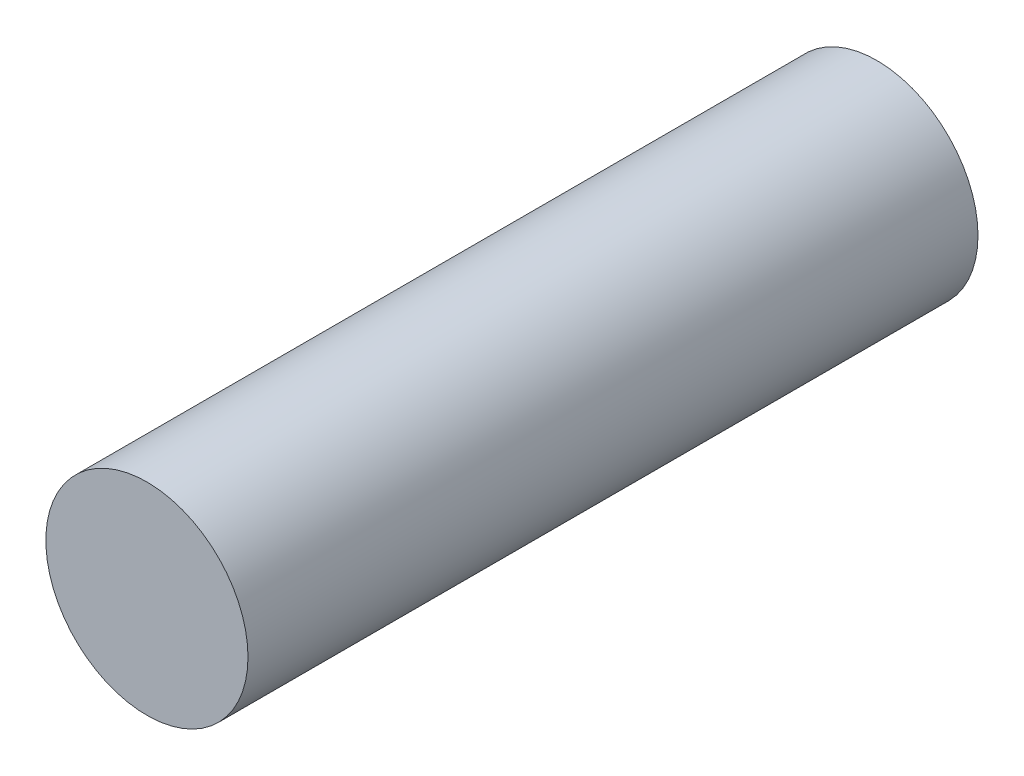
from build123d import *

# Parameters (mm, degrees)
SKETCH1_R           = 9
BOSS_EXTRUDE1_DEPTH = 65


with BuildPart() as part:
    # Sketch1 → Boss-Extrude1 (new body)
    with BuildSketch(Plane.XY):
        Circle(SKETCH1_R)
    extrude(amount=BOSS_EXTRUDE1_DEPTH)


solid = part.part
